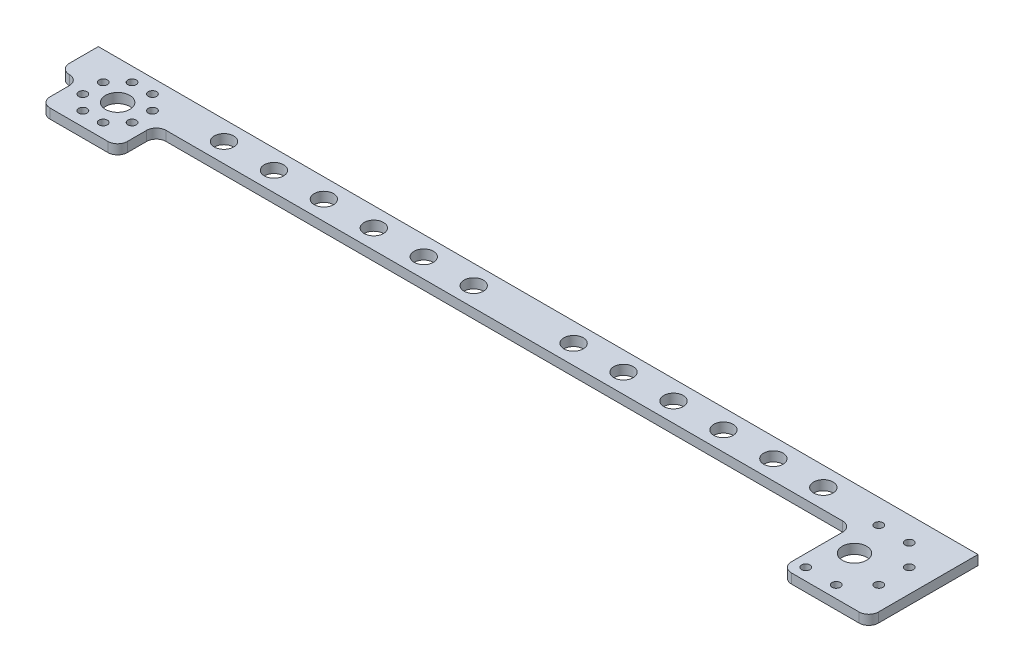
from build123d import *

# Parameters (mm, degrees)
BOSS_EXTRUDE1_DEPTH       = 6.35
M5_CLEARANCE_HOLE1_D      = 5.5
M5_CLEARANCE_HOLE1_DEPTH  = 12.7
M5_CLEARANCE_HOLE1_TIP    = 1.652366702
F_6_CLEARANCE_HOLE2_D     = 3.7973
F_6_CLEARANCE_HOLE2_DEPTH = 12.7
F_6_CLEARANCE_HOLE2_TIP   = 1.140824014
M5_CLEARANCE_HOLE2_D      = 5.5
M5_CLEARANCE_HOLE2_DEPTH  = 12.7
M5_CLEARANCE_HOLE2_TIP    = 1.652366702
FILLET1_R                 = 6.35
SKETCH8_R                 = 8
CUT_EXTRUDE1_DEPTH        = 6.35
SKETCH11_R                = 6.35
CUT_EXTRUDE2_DEPTH        = 6.35


with BuildPart() as part:
    # Sketch1 → Boss-Extrude1 (new body)
    with BuildSketch(Plane(origin=(0, 0, 0), x_dir=(1, 0, 0), z_dir=(0, 1, 0))):
        Polygon((-228.6, 12.7), (228.6, 12.7), (285.75, 12.7), (285.75, -59.055), (228.6, -59.055), (228.6, -12.7), (-228.6, -12.7), (-228.6, -38.1), (-279.4, -38.1), (-279.4, -12.7), (-292.1, -12.7), (-292.1, 12.7), (-279.4, 12.7), align=None)
    extrude(amount=BOSS_EXTRUDE1_DEPTH)

    # M5 Clearance Hole1
    with Locations(Plane(origin=(0, 6.35, 0), x_dir=(1, 0, 0), z_dir=(0, 1, 0))):
        with Locations((-270.167891819, -6.003039934), (-260.696960066, -28.867891819), (-237.832108181, -19.396960066), (-260.696960066, 3.467891819), (-247.303039934, 3.467891819), (-237.832108181, -6.003039934), (-270.167891819, -19.396960066), (-247.303039934, -28.867891819)):
            Hole(M5_CLEARANCE_HOLE1_D / 2, depth=M5_CLEARANCE_HOLE1_DEPTH)
            with Locations((0, 0, -(M5_CLEARANCE_HOLE1_DEPTH + M5_CLEARANCE_HOLE1_TIP / 2))):  # 118° drill point
                Cone(0, M5_CLEARANCE_HOLE1_D / 2, M5_CLEARANCE_HOLE1_TIP, mode=Mode.SUBTRACT)

    # #6 Clearance Hole2
    with Locations(Plane(origin=(0, 0, -12.7), x_dir=(-1, 0, 0), z_dir=(0, 0, -1))):
        with Locations((279.4, 3.175), (215.9, 3.175), (0, 3.175), (-215.9, 3.175), (-276.225, 3.175)):
            Hole(F_6_CLEARANCE_HOLE2_D / 2, depth=F_6_CLEARANCE_HOLE2_DEPTH)
            with Locations((0, 0, -(F_6_CLEARANCE_HOLE2_DEPTH + F_6_CLEARANCE_HOLE2_TIP / 2))):  # 118° drill point
                Cone(0, F_6_CLEARANCE_HOLE2_D / 2, F_6_CLEARANCE_HOLE2_TIP, mode=Mode.SUBTRACT)

    # M5 Clearance Hole2
    with Locations(Plane(origin=(0, 6.35, 0), x_dir=(1, 0, 0), z_dir=(0, 1, 0))):
        with Locations((218.475, -17.174999994), (218.475, -37.174999994), (244.475, -27.174999994), (256.475, -3.175), (256.475, -51.175), (236.475, -3.175), (236.475, -51.175), (270.475, -17.174999994), (270.475, -37.174999994)):
            Hole(M5_CLEARANCE_HOLE2_D / 2, depth=M5_CLEARANCE_HOLE2_DEPTH)
            with Locations((0, 0, -(M5_CLEARANCE_HOLE2_DEPTH + M5_CLEARANCE_HOLE2_TIP / 2))):  # 118° drill point
                Cone(0, M5_CLEARANCE_HOLE2_D / 2, M5_CLEARANCE_HOLE2_TIP, mode=Mode.SUBTRACT)

    # Fillet1
    fillet1_edges = [part.edges().sort_by_distance(p)[0] for p in [
        (285.75, 3.175, 59.055),
        (228.6, 3.175, 59.055),
        (228.6, 3.175, 12.7),
        (-228.6, 3.175, 12.7),
        (-228.6, 3.175, 38.1),
        (-279.4, 3.175, 38.1),
        (-279.4, 3.175, 12.7),
        (-292.1, 3.175, 12.7),
    ]]
    fillet(fillet1_edges, radius=FILLET1_R - 0.0001)  # a hair under: the kernel refuses the full size

    # Sketch8 → Cut-Extrude1 (cut)
    with BuildSketch(Plane(origin=(0, 6.35, 0), x_dir=(1, 0, 0), z_dir=(0, 1, 0))):
        with Locations(Location((-254, -12.7, 0), (0, 0, 270))):
            Circle(SKETCH8_R)
        with Locations(Location((244.475, -27.174999994, 0), (0, 0, 270))):
            Circle(SKETCH8_R)
    extrude(amount=-CUT_EXTRUDE1_DEPTH, mode=Mode.SUBTRACT)

    # Sketch11 → Cut-Extrude2 (cut)
    with BuildSketch(Plane(origin=(0, 6.35, 0), x_dir=(1, 0, 0), z_dir=(0, 1, 0))):
        with Locations(Location((-196.85, 0, 0), (0, 0, 270))):
            Circle(SKETCH11_R)
        with Locations(Location((-164.041666667, 0, 0), (0, 0, 270))):
            Circle(SKETCH11_R)
        with Locations(Location((-131.233333333, 0, 0), (0, 0, 270))):
            Circle(SKETCH11_R)
        with Locations(Location((-98.425, 0, 0), (0, 0, 270))):
            Circle(SKETCH11_R)
        with Locations(Location((-65.616666667, 0, 0), (0, 0, 270))):
            Circle(SKETCH11_R)
        with Locations(Location((-32.808333333, 0, 0), (0, 0, 270))):
            Circle(SKETCH11_R)
    cut_extrude2 = extrude(amount=-CUT_EXTRUDE2_DEPTH, mode=Mode.SUBTRACT)

    # Mirror1: Cut-Extrude2 across plane
    add(cut_extrude2.mirror(Plane(origin=(0, 0, 0), x_dir=(0, 0, 1), z_dir=(1, 0, 0))), mode=Mode.SUBTRACT)


solid = part.part
